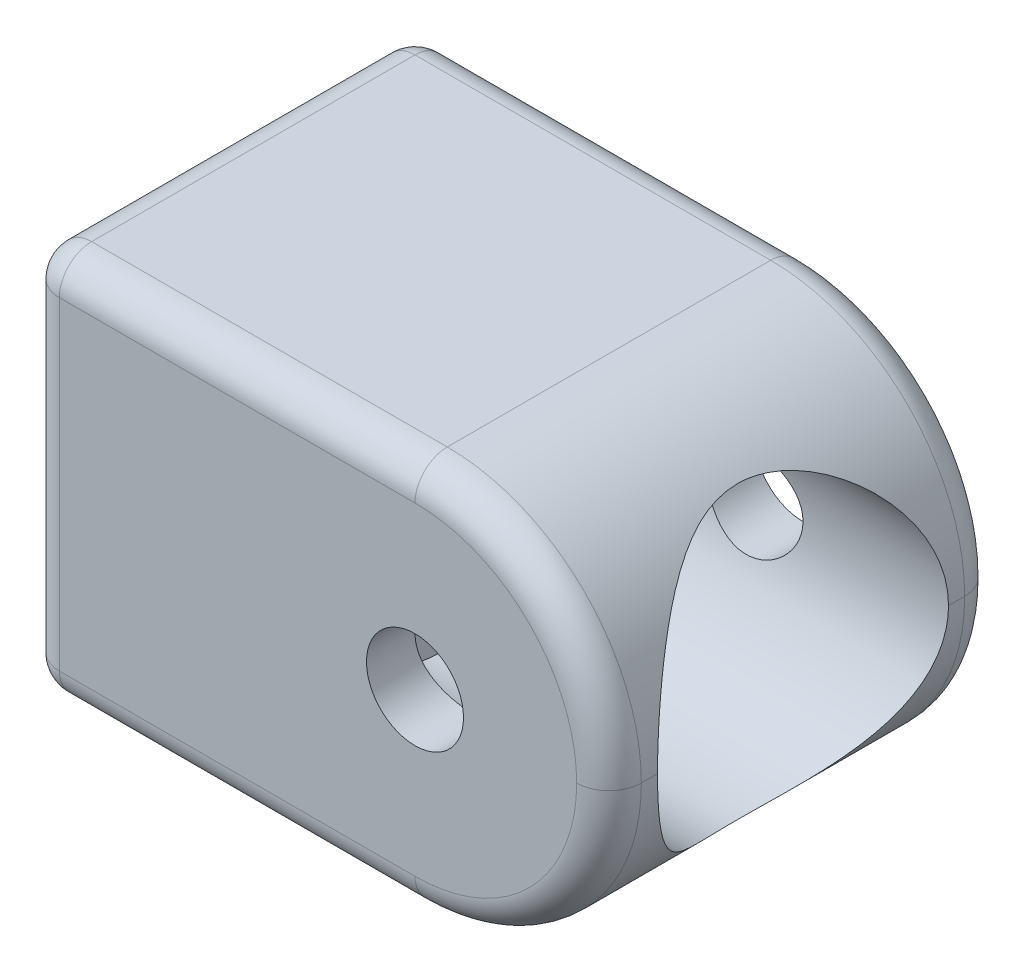
from build123d import *

# Parameters (mm, degrees)
SKETCH1_W           = 38.1
SKETCH1_H           = 25.4
SKETCH1_R           = 3.175
BOSS_EXTRUDE1_DEPTH = 25.4
SKETCH2_R           = 9.525
SKETCH2_R_2         = 5.55625
CUT_EXTRUDE1_DEPTH  = 23.495
SKETCH2_4_R         = 5.55625
CUT_EXTRUDE2_DEPTH  = 48.519048865
FILLET1_DEPTH       = 25.4
FILLET2_R           = 2.116666667


with BuildPart() as part:
    # Sketch1 → Boss-Extrude1 (new body)
    with BuildSketch(Plane.XY):
        with Locations((-6.35, 0)):
            Rectangle(SKETCH1_W, SKETCH1_H)
        Circle(SKETCH1_R, mode=Mode.SUBTRACT)
    extrude(amount=BOSS_EXTRUDE1_DEPTH)

    # Sketch2 → Cut-Extrude1 (cut)
    # profile 1 of 2: a face of its own
    with BuildSketch(Plane(origin=(12.7, 0, 0), x_dir=(0, 0, -1), z_dir=(1, 0, 0))):
        with Locations(Location((-12.7, 0, 0), (0, 0, 90))):
            Circle(SKETCH2_R)
        with Locations((-12.7, 0)):
            Circle(SKETCH2_R_2, mode=Mode.SUBTRACT)
    # profile 2 of 2: a face of its own
    with BuildSketch(Plane(origin=(12.7, 0, 0), x_dir=(0, 0, -1), z_dir=(1, 0, 0))):
        with Locations((-12.7, 0)):
            Circle(SKETCH2_R_2)
    extrude(amount=-CUT_EXTRUDE1_DEPTH, mode=Mode.SUBTRACT)

    # Sketch2<4> → Cut-Extrude2 (cut, through all)
    with BuildSketch(Plane(origin=(12.7, 0, 0), x_dir=(0, 0, -1), z_dir=(1, 0, 0))):
        with Locations(Location((-12.7, 0, 0), (0, 0, 90))):
            Circle(SKETCH2_4_R)
    extrude(amount=-CUT_EXTRUDE2_DEPTH, mode=Mode.SUBTRACT)

    # Fillet1: read off the stored shape, not the designer's step
    # Fillet1 outline → Fillet1 (cut)
    with BuildSketch(Plane.XY):
        with BuildLine():
            Line((12.7, 12.7), (0, 12.7))
            ThreePointArc((0, 12.7), (8.980256121, 8.980256121), (12.7, 0))
            Line((12.7, 0), (12.7, 12.7))
        make_face()
        with BuildLine():
            Line((12.7, -12.7), (12.7, 0))
            ThreePointArc((12.7, 0), (8.980256121, -8.980256121), (0, -12.7))
            Line((0, -12.7), (12.7, -12.7))
        make_face()
    extrude(amount=FILLET1_DEPTH, mode=Mode.SUBTRACT)

    # Fillet2
    fillet2_edges = [part.edges().sort_by_distance(p)[0] for p in [
        (-25.4, 0, 25.4),
        (-12.7, -12.7, 25.4),
        (-12.7, 12.7, 0),
        (8.980256121, 8.980256121, 0),
        (8.980256121, -8.980256121, 0),
        (-12.7, 12.7, 25.4),
        (8.980256121, 8.980256121, 25.4),
        (8.980256121, -8.980256121, 25.4),
        (-12.7, -12.7, 0),
        (-25.4, 0, 0),
        (-25.4, -12.7, 12.7),
        (-25.4, 12.7, 12.7),
    ]]
    fillet(fillet2_edges, radius=FILLET2_R)


solid = part.part
